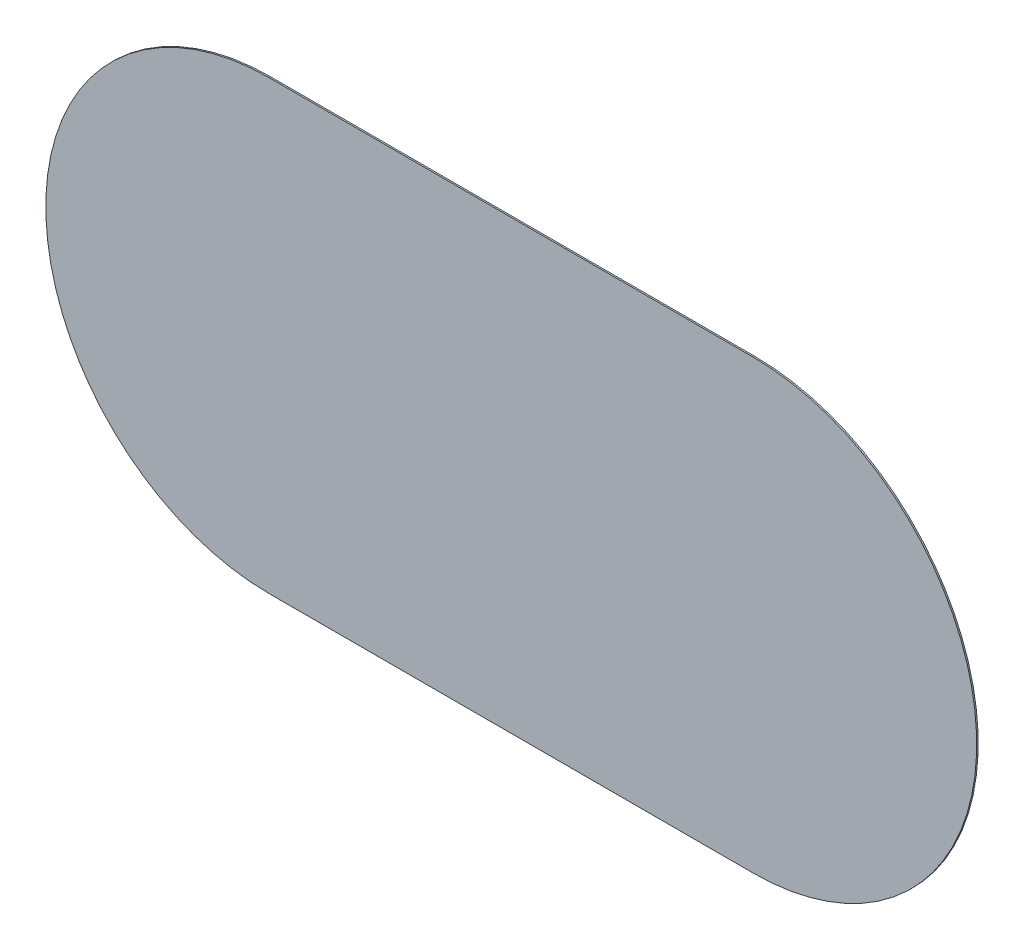
from build123d import *

# Parameters (mm, degrees)
BASE_FLANGE1_DEPTH = 1


# Sheet-metal steps are written as plain solids
with BuildPart() as part:
    # Sketch1 → Base-Flange1 (new body)
    with BuildSketch(Plane.XY):
        with BuildLine():
            Line((-162.5, 150), (162.5, 150))
            ThreePointArc((162.5, 150), (312.5, 0), (162.5, -150))
            Line((162.5, -150), (-162.5, -150))
            ThreePointArc((-162.5, -150), (-312.5, 0), (-162.5, 150))
        make_face()
    extrude(amount=-BASE_FLANGE1_DEPTH)


solid = part.part
